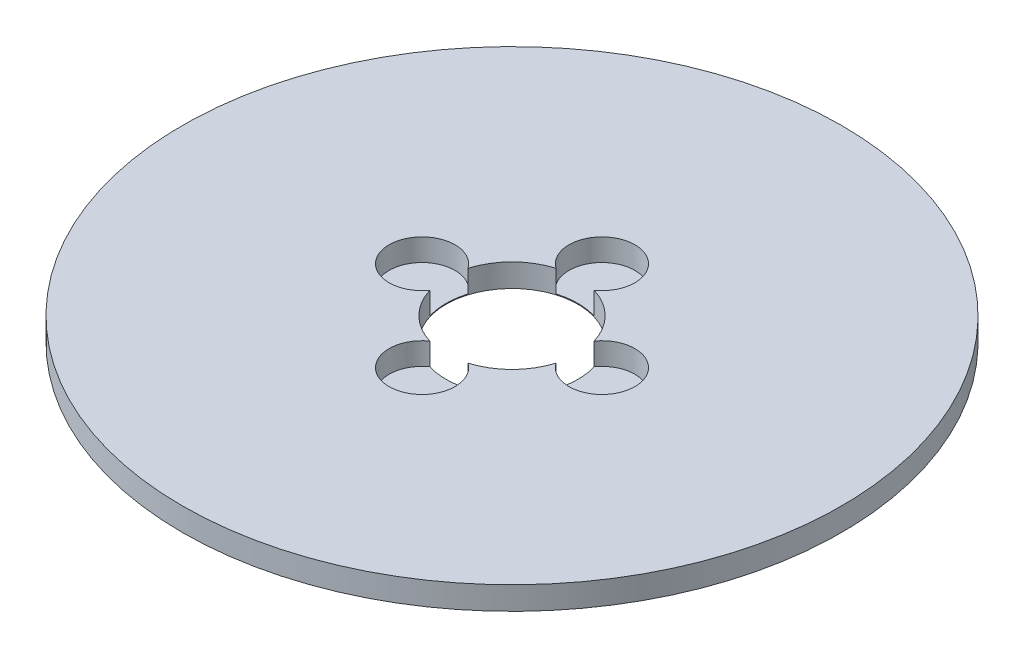
from build123d import *

# Parameters (mm, degrees)
SKETCH1_R           = 100
BOSS_EXTRUDE1_DEPTH = 7
SKETCH2_R           = 20
CUT_EXTRUDE1_DEPTH  = 142.594491418
SKETCH3_R           = 10
CUT_EXTRUDE2_DEPTH  = 6.746851864
CIRPATTERN1_COUNT   = 4


with BuildPart() as part:
    # Sketch1 → Boss-Extrude1 (new body)
    with BuildSketch(Plane(origin=(0, 0, 0), x_dir=(1, 0, 0), z_dir=(0, 1, 0))):
        Circle(SKETCH1_R)
    extrude(amount=BOSS_EXTRUDE1_DEPTH)

    # Sketch2 → Cut-Extrude1 (cut, through all)
    with BuildSketch(Plane(origin=(0, 0, 0), x_dir=(1, 0, 0), z_dir=(0, 1, 0))):
        Circle(SKETCH2_R)
    extrude(amount=CUT_EXTRUDE1_DEPTH, mode=Mode.SUBTRACT)

    # Sketch3 → Cut-Extrude2 (cut)
    with BuildSketch(Plane(origin=(0, 7, 0), x_dir=(1, 0, 0), z_dir=(0, 1, 0))):
        with Locations((-27.2907537, 0)):
            Circle(SKETCH3_R)
    cut_extrude2 = extrude(amount=-CUT_EXTRUDE2_DEPTH, mode=Mode.SUBTRACT)

    # CirPattern1: Cut-Extrude2 ×4 about axis
    cirpattern1_axis = Axis((0, 0, 0), (0, 1, 0))
    for i in range(1, CIRPATTERN1_COUNT):
        add(cut_extrude2.rotate(cirpattern1_axis, i * 360 / CIRPATTERN1_COUNT), mode=Mode.SUBTRACT)


solid = part.part
